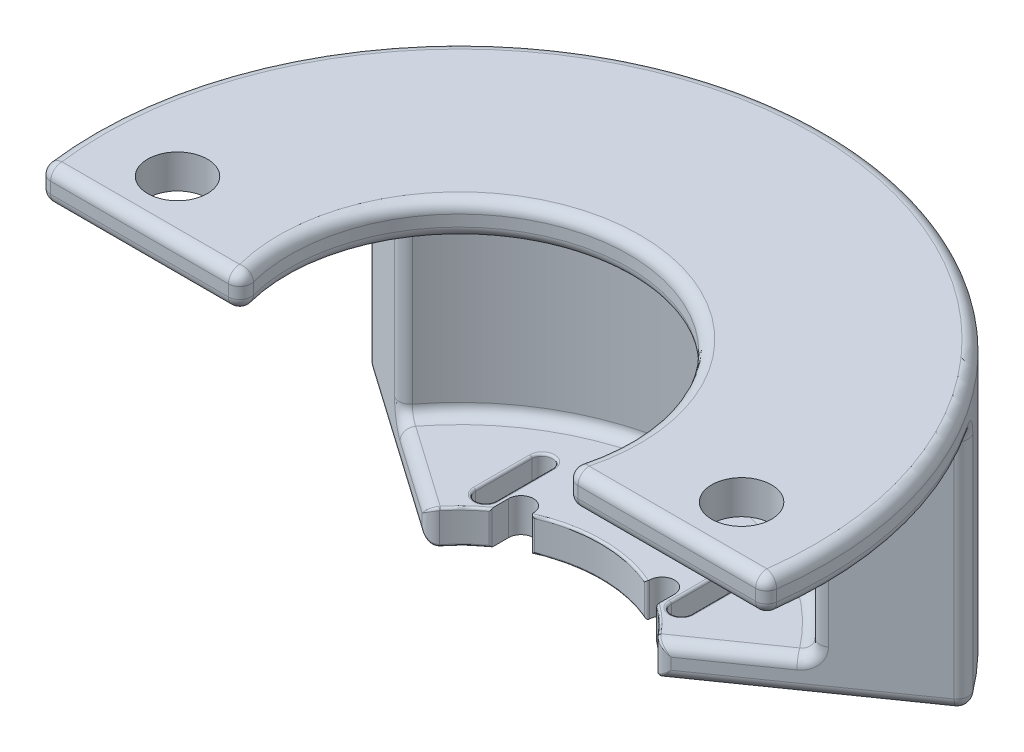
from build123d import *

# Parameters (mm, degrees)
SKETCH1_R                = 32.5
SKETCH1_R_2              = 15.000000000000002
BOSS_EXTRUDE1_DEPTH      = 3
M5_CLEARANCE_HOLE1_D     = 5.3
M5_CLEARANCE_HOLE1_DEPTH = 10.1
M5_CLEARANCE_HOLE1_TIP   = 1.5922806404230347
SKETCH4_W                = 76.89804713858805
SKETCH4_H                = 33.240395512635246
CUT_EXTRUDE1_DEPTH       = 47.05974381170612
BOSS_EXTRUDE3_START      = 21.76
BOSS_EXTRUDE3_DEPTH      = 21.76
BOSS_EXTRUDE4_DEPTH      = 3
CUT_EXTRUDE2_REACH       = 54.207
FILLET1_R                = 1
FILLET2_R                = 0.2


with BuildPart() as part:
    # Sketch1 → Boss-Extrude1 (new body)
    with BuildSketch(Plane(origin=(0, 0, 0), x_dir=(1, 0, 0), z_dir=(0, 1, 0))):
        Circle(SKETCH1_R)
        Circle(SKETCH1_R_2, mode=Mode.SUBTRACT)
    extrude(amount=BOSS_EXTRUDE1_DEPTH)

    # M5 Clearance Hole1
    with Locations(Plane(origin=(0, 3, 0), x_dir=(1, 0, 0), z_dir=(0, 1, 0))):
        with Locations((25, 0), (-25, 0)):
            Hole(M5_CLEARANCE_HOLE1_D / 2, depth=M5_CLEARANCE_HOLE1_DEPTH)
            with Locations((0, 0, -(M5_CLEARANCE_HOLE1_DEPTH + M5_CLEARANCE_HOLE1_TIP / 2))):  # 118° drill point
                Cone(0, M5_CLEARANCE_HOLE1_D / 2, M5_CLEARANCE_HOLE1_TIP, mode=Mode.SUBTRACT)

    # Sketch4 → Cut-Extrude1 (cut, through all)
    with BuildSketch(Plane.XZ):
        with Locations((1.9235361561769082, 21.620197756317623)):
            Rectangle(SKETCH4_W, SKETCH4_H)
    extrude(amount=-CUT_EXTRUDE1_DEPTH, mode=Mode.SUBTRACT)

    # Sketch9 → Boss-Extrude3 (add)
    with BuildSketch(Plane.XZ.offset(BOSS_EXTRUDE3_START)):
        with BuildLine():
            Line((-18.430920996502348, -12.905469817898506), (-26.62244143939228, -18.64123418140895))
            ThreePointArc((-26.62244143939228, -18.64123418140895), (1.99e-15, -32.50000000000001), (26.622441439392286, -18.641234181408944))
            Line((26.622441439392286, -18.641234181408944), (18.430920996502355, -12.905469817898501))
            ThreePointArc((18.430920996502355, -12.905469817898501), (6.37e-15, -22.50000000000001), (-18.430920996502348, -12.905469817898506))
        make_face()
    extrude(amount=-BOSS_EXTRUDE3_DEPTH)

    # Sketch10 → Boss-Extrude4 (add)
    with BuildSketch(Plane.XZ.offset(21.76)):
        with BuildLine():
            Line((-18.430920996502348, -12.905469817898506), (-10.239400553612423, -7.169705454388065))
            ThreePointArc((-10.239400553612423, -7.169705454388065), (7.7e-16, -12.500000000000014), (10.239400553612423, -7.169705454388065))
            Line((10.239400553612423, -7.169705454388065), (18.43092099650236, -12.905469817898497))
            Line((18.43092099650236, -12.905469817898497), (26.622441439392286, -18.641234181408947))
            ThreePointArc((26.622441439392286, -18.641234181408947), (1.99e-15, -32.500000000000014), (-26.622441439392286, -18.641234181408947))
            Line((-26.622441439392286, -18.641234181408947), (-18.430920996502348, -12.905469817898506))
        make_face()
    extrude(amount=-BOSS_EXTRUDE4_DEPTH)

    # Sketch11 → Cut-Extrude2 (cut, up to next)
    with BuildSketch(Plane.XZ.offset(21.76), mode=Mode.PRIVATE) as cut_extrude2_sk1:
        with BuildLine():
            Line((-9.574999999999996, -16), (-9.574999999999998, -11))
            ThreePointArc((-9.574999999999998, -11), (-8.674999999999995, -10.100000000000003), (-7.774999999999999, -11))
            Line((-7.774999999999999, -11), (-7.774999999999999, -16))
            ThreePointArc((-7.774999999999999, -16), (-8.674999999999999, -16.9), (-9.574999999999996, -16))
        make_face()
    cut_extrude2_tool1 = extrude(cut_extrude2_sk1.sketch, amount=-CUT_EXTRUDE2_REACH, mode=Mode.PRIVATE) & part.part
    # Sketch11 → Cut-Extrude2 (cut, up to next)
    with BuildSketch(Plane.XZ.offset(21.76), mode=Mode.PRIVATE) as cut_extrude2_sk2:
        with BuildLine():
            Line((9.575, -15.999999999999996), (9.575, -10.999999999999998))
            ThreePointArc((9.575, -10.999999999999998), (8.674999999999999, -10.100000000000001), (7.775000000000002, -10.999999999999998))
            Line((7.775000000000002, -10.999999999999998), (7.775000000000002, -15.999999999999996))
            ThreePointArc((7.775000000000002, -15.999999999999996), (8.674999999999999, -16.9), (9.575, -15.999999999999996))
        make_face()
    cut_extrude2_tool2 = extrude(cut_extrude2_sk2.sketch, amount=-CUT_EXTRUDE2_REACH, mode=Mode.PRIVATE) & part.part
    # Sketch11 → Cut-Extrude2 (cut, up to next)
    with BuildSketch(Plane.XZ.offset(21.76), mode=Mode.PRIVATE) as cut_extrude2_sk3:
        with BuildLine():
            Line((-7.349999999999999, -11.7), (-7.349999999999999, -8.7))
            ThreePointArc((-7.349999999999999, -8.7), (-6.250000000000002, -7.600000000000003), (-5.150000000000004, -8.699999999999996))
            Line((-5.150000000000004, -8.699999999999996), (-5.150000000000004, -11.700000000000003))
            ThreePointArc((-5.150000000000004, -11.700000000000003), (-6.250000000000002, -12.799999999999997), (-7.349999999999999, -11.7))
        make_face()
    cut_extrude2_tool3 = extrude(cut_extrude2_sk3.sketch, amount=-CUT_EXTRUDE2_REACH, mode=Mode.PRIVATE) & part.part
    # Sketch11 → Cut-Extrude2 (cut, up to next)
    with BuildSketch(Plane.XZ.offset(21.76), mode=Mode.PRIVATE) as cut_extrude2_sk4:
        with BuildLine():
            Line((7.3500000000000005, -11.700000000000001), (7.3500000000000005, -8.699999999999998))
            ThreePointArc((7.3500000000000005, -8.699999999999998), (6.25, -7.600000000000004), (5.150000000000007, -8.699999999999998))
            Line((5.150000000000007, -8.699999999999998), (5.150000000000007, -11.700000000000001))
            ThreePointArc((5.150000000000007, -11.700000000000001), (6.25, -12.8), (7.3500000000000005, -11.700000000000001))
        make_face()
    cut_extrude2_tool4 = extrude(cut_extrude2_sk4.sketch, amount=-CUT_EXTRUDE2_REACH, mode=Mode.PRIVATE) & part.part
    add(cut_extrude2_tool1.solids().sort_by_distance((-8.675, -21.76, -13.5))[0], mode=Mode.SUBTRACT)
    add(cut_extrude2_tool2.solids().sort_by_distance((8.675, -21.76, -13.5))[0], mode=Mode.SUBTRACT)
    add(cut_extrude2_tool3.solids().sort_by_distance((-6.25, -21.76, -10.2))[0], mode=Mode.SUBTRACT)
    add(cut_extrude2_tool4.solids().sort_by_distance((6.25, -21.76, -10.2))[0], mode=Mode.SUBTRACT)

    # Fillet1
    fillet1_edges = [part.edges().sort_by_distance(p)[0] for p in [
        (-22.526681217947313, 0, -15.773351999653729),
        (-14.335160775057386, -18.76, -10.037587636143284),
        (-10.239400553612423, -20.26, -7.169705454388065),
        (-18.430920996502355, -21.76, -12.905469817898506),
        (18.43092099650236, -21.76, -12.905469817898506),
        (10.239400553612423, -20.26, -7.169705454388065),
        (14.33516077505739, -18.76, -10.037587636143288),
        (22.52668121794732, 0, -15.773351999653723),
        (-18.43092099650235, -9.38, -12.905469817898506),
        (5.33e-15, 0, -22.500000000000014),
        (18.43092099650236, -9.38, -12.905469817898503),
        (-5.33e-15, -18.76, -22.500000000000014),
        (23.127608535196842, 0, 5),
        (23.127608535196885, 3, 5),
        (7.11e-15, -21.76, -32.50000000000001),
        (26.62244143939229, -10.88, -18.641234181408947),
        (31.657422519523532, 0, -7.352387327961216),
        (32.113081446662825, 1.5, 5),
        (1.78e-15, 3, -32.5),
        (-31.6574225195234, 0, -7.3523873279617735),
        (-26.622441439392283, -10.88, -18.641234181408947),
        (-32.113081446662825, 1.5, 5),
        (-23.12760853519689, 3, 5),
        (-23.12760853519707, 0, 5),
        (8.793e-14, 0, -15.000000000000004),
        (-14.142135623730953, 1.5, 5),
        (0, 3, -15.000000000000004),
        (14.142135623730953, 1.5, 5),
    ]]
    fillet(fillet1_edges, radius=FILLET1_R)

    # Fillet2
    fillet2_edges = [part.edges().sort_by_distance(p)[0] for p in [
        (10.3924652665415, -19.13663760372768, -7.543093089385867),
        (10.392465172814227, -21.383362469702636, -7.5430930952204385),
        (-10.392465266541496, -21.383362396272318, -7.543093089385871),
        (-9.656651981084039, -21.759313112524406, -7.937195506991101),
        (-10.392465266541496, -19.136637603727685, -7.543093089385871),
        (-9.656651981083618, -18.760686887497258, -7.9371955069882585),
        (8.675, -18.76, -16.9),
        (9.575, -18.76, -13.499999999999996),
        (8.675, -18.76, -10.100000000000001),
        (-9.574999999999998, -18.76, -13.5),
        (-8.674999999999997, -18.76, -16.9),
        (-7.774999999999999, -18.76, -13.5),
        (-8.674999999999997, -21.76, -16.9),
        (-9.574999999999996, -21.76, -13.5),
        (-8.674999999999999, -21.76, -10.100000000000003),
        (8.675, -21.76, -10.100000000000001),
        (9.575, -21.76, -13.499999999999996),
        (8.675, -21.76, -16.9),
        (7.35, -20.26, -10.110761593470613),
        (8.558957312425767, -18.76, -9.11011798628722),
        (9.656651981084044, -18.76068688747559, -7.9371955069910936),
        (9.656651981084044, -21.75931311252441, -7.937195506991093),
        (8.558957312425877, -21.76, -9.110117986287117),
        (3.11e-15, -21.76, -12.500000000000016),
        (-5.150000000000004, -20.26, -11.389798066691101),
        (3.11e-15, -18.76, -12.500000000000016),
        (5.150000000000006, -20.26, -11.389798066691101),
        (-7.35, -20.26, -10.110761593470613),
        (-8.558957312425873, -21.76, -9.11011798628712),
        (-8.558957312425767, -18.76, -9.110117986287218),
        (7.775000000000002, -18.76, -13.499999999999996),
        (-8.674999999999999, -18.76, -10.100000000000003),
        (-7.774999999999999, -21.76, -13.5),
        (7.775000000000002, -21.76, -13.499999999999996),
    ]]
    fillet(fillet2_edges, radius=FILLET2_R)


solid = part.part
